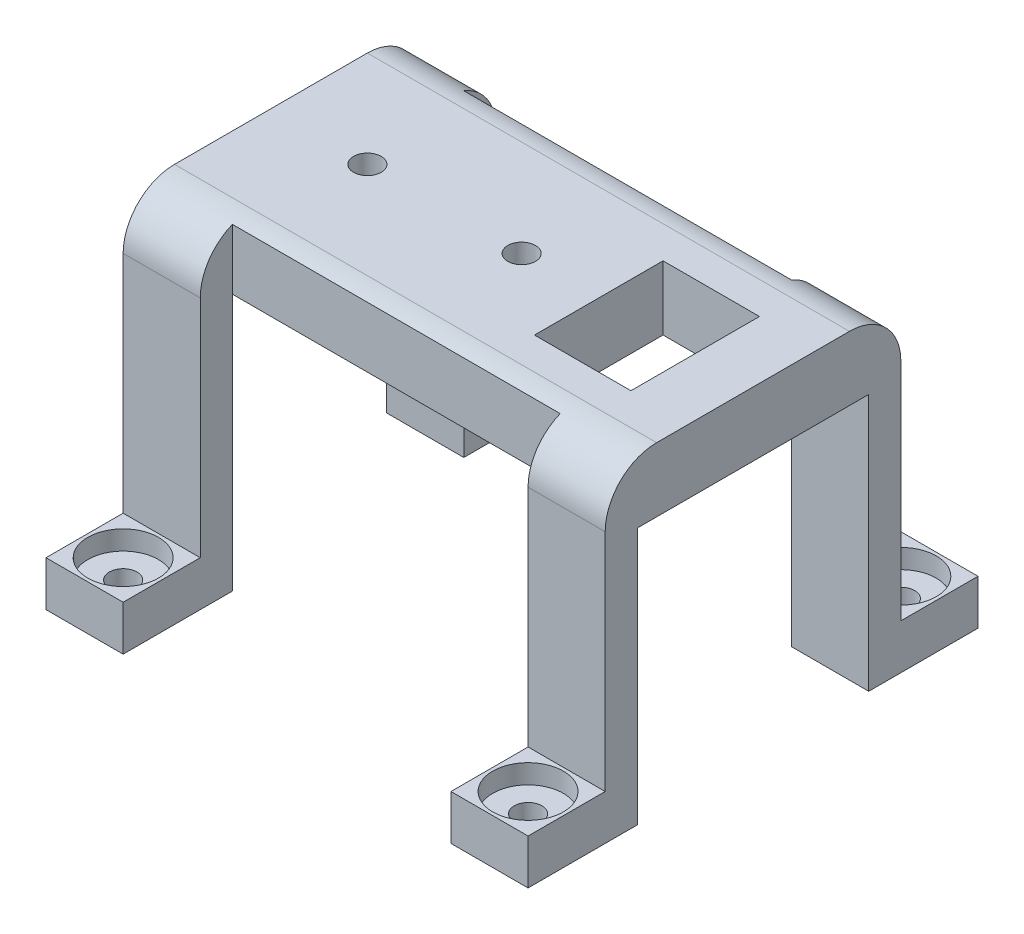
from build123d import *

# Parameters (mm, degrees)
STRUCTURE_W                                     = 75
STRUCTURE_H                                     = 18
BOSS_CORPS_DEPTH                                = 10
BOSS_PATES_OUTLINE_W                            = 50
BOSS_PATES_OUTLINE_H                            = 5
BOSS_PATES_DEPTH                                = 12
BOSS_PATES_START                                = 63
BOSS_PATES_2_OUTLINE_W                          = 50
BOSS_PATES_2_OUTLINE_H                          = 5
BOSS_PATES_2_DEPTH                              = 12
SKETCH2_W                                       = 12
SKETCH2_H                                       = 7
BOSS_ATTACHES_DEPTH                             = 12
F_6_CLEARANCE_HOLE1_D                           = 4.3053
CBORE_FOR_6_PAN_HEAD_MACHINE_SCREW1_D           = 4.3053
CBORE_FOR_6_PAN_HEAD_MACHINE_SCREW1_CBORE_D     = 11.0000034
CBORE_FOR_6_PAN_HEAD_MACHINE_SCREW1_CBORE_DEPTH = 2.999994
FILLET1_R                                       = 8
CUT_EXTRUDE1_REACH                              = 98.695
SKETCH10_W                                      = 15
SKETCH10_H                                      = 20


# Read off the part's stored shape, not the designer's step: Boss-Pates
with BuildPart() as part:
    # Structure → Boss-Corps (new body)
    with BuildSketch(Plane(origin=(0, 0, 0), x_dir=(1, 0, 0), z_dir=(0, 1, 0))):
        with Locations((37.5, 9)):
            Rectangle(STRUCTURE_W, STRUCTURE_H)
    extrude(amount=-BOSS_CORPS_DEPTH)

    # Boss-Pates outline → Boss-Pates (add)
    with BuildSketch(Plane.YZ):
        with Locations((-25, -20.5)):
            Rectangle(BOSS_PATES_OUTLINE_W, BOSS_PATES_OUTLINE_H)
    extrude(amount=BOSS_PATES_DEPTH)

    # Boss-Pates 2 outline → Boss-Pates 2 (add)
    with BuildSketch(Plane.YZ.offset(BOSS_PATES_START)):
        with Locations((-25, -20.5)):
            Rectangle(BOSS_PATES_2_OUTLINE_W, BOSS_PATES_2_OUTLINE_H)
    extrude(amount=BOSS_PATES_2_DEPTH)

    # Sketch2 → Boss-Attaches (add)
    with BuildSketch(Plane(origin=(0, 0, -23), x_dir=(-1, 0, 0), z_dir=(0, 0, -1))):
        with Locations((-69, -46.5)):
            Rectangle(SKETCH2_W, SKETCH2_H)
        with Locations((-6, -46.5)):
            Rectangle(SKETCH2_W, SKETCH2_H)
    extrude(amount=BOSS_ATTACHES_DEPTH)

    # Mirror4: part across plane


with BuildPart() as part_1:
    add(part.part)
    add(part.part.mirror(Plane(origin=(0, -10, 0), x_dir=(1, 0, 0), z_dir=(0, 0, 1))))

    # #6 Clearance Hole1 (through all)
    with Locations(Plane(origin=(0, 0, 0), x_dir=(1, 0, 0), z_dir=(0, 1, 0))):
        with Locations((15, 0), (39, 0)):
            Hole(F_6_CLEARANCE_HOLE1_D / 2)

    # CBORE for #6 Pan Head Machine Screw1 (through all)
    with Locations(Plane(origin=(0, -43, 0), x_dir=(1, 0, 0), z_dir=(0, 1, 0))):
        with Locations((6, 29), (69, 29), (69, -29), (6, -29)):
            CounterBoreHole(CBORE_FOR_6_PAN_HEAD_MACHINE_SCREW1_D / 2, CBORE_FOR_6_PAN_HEAD_MACHINE_SCREW1_CBORE_D / 2, CBORE_FOR_6_PAN_HEAD_MACHINE_SCREW1_CBORE_DEPTH)

    # Fillet1
    fillet1_edges = [part_1.edges().sort_by_distance(p)[0] for p in [
        (69, 0, -23),
        (6, 0, 23),
    ]]
    fillet(fillet1_edges, radius=FILLET1_R)

    # Sketch10 → Cut-Extrude1 (cut, up to next)
    with BuildSketch(Plane(origin=(0, 0, 0), x_dir=(1, 0, 0), z_dir=(0, 1, 0)), mode=Mode.PRIVATE) as cut_extrude1_sk1:
        with Locations((58.5, 0)):
            Rectangle(SKETCH10_W, SKETCH10_H)
    cut_extrude1_tool1 = extrude(cut_extrude1_sk1.sketch, amount=-CUT_EXTRUDE1_REACH, mode=Mode.PRIVATE) & part_1.part
    add(cut_extrude1_tool1.solids().sort_by_distance((58.5, 0, 0))[0], mode=Mode.SUBTRACT)


solid = part_1.part
